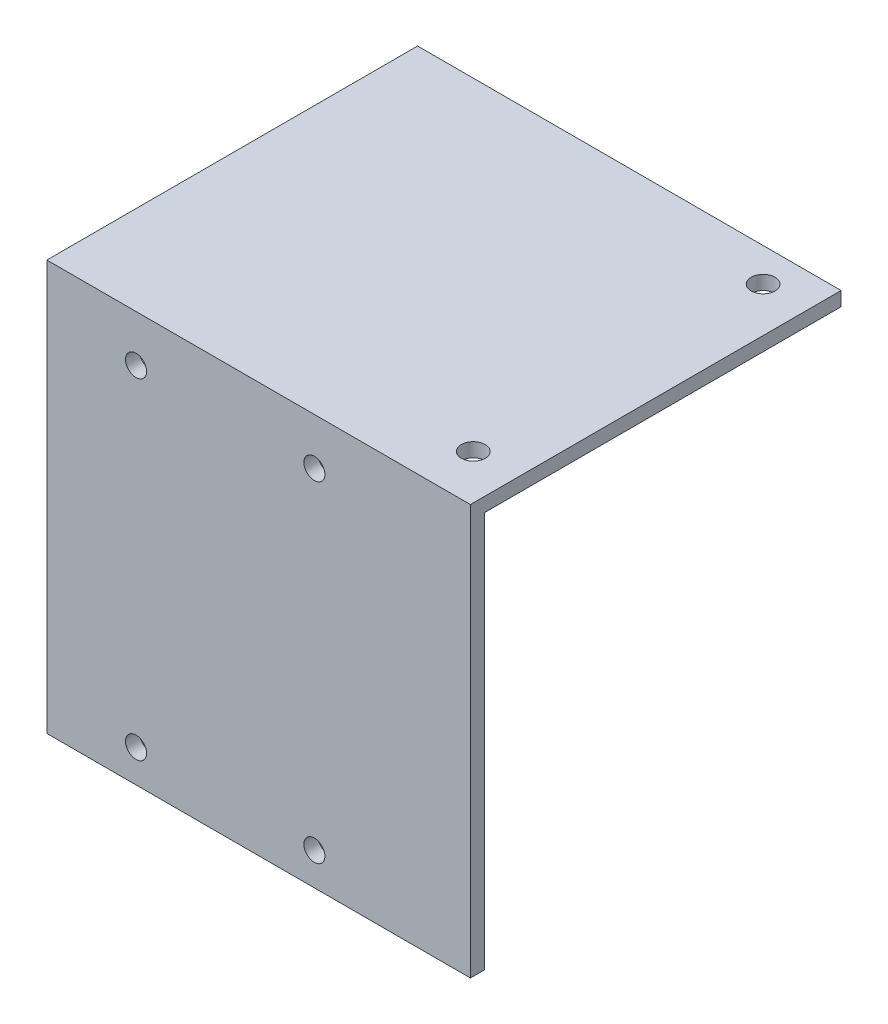
from build123d import *

# Parameters (mm, degrees)
SKETCH1_W           = 60.325
SKETCH1_H           = 58.4
SKETCH1_R           = 1.5
BOSS_EXTRUDE1_DEPTH = 2
SKETCH2_W           = 60.325
SKETCH2_H           = 2
BOSS_EXTRUDE2_DEPTH = 50.8
SKETCH3_R           = 1.7
CUT_EXTRUDE1_DEPTH  = 100.184200481


with BuildPart() as part:
    # Sketch1 → Boss-Extrude1 (new body)
    with BuildSketch(Plane.XY):
        with Locations((30.1625, 29.2)):
            Rectangle(SKETCH1_W, SKETCH1_H)
        with Locations((12.7, 51.75)):
            Circle(SKETCH1_R, mode=Mode.SUBTRACT)
        with Locations((38.1, 51.75)):
            Circle(SKETCH1_R, mode=Mode.SUBTRACT)
        with Locations((12.7, 4.65)):
            Circle(SKETCH1_R, mode=Mode.SUBTRACT)
        with Locations((38.1, 4.65)):
            Circle(SKETCH1_R, mode=Mode.SUBTRACT)
    extrude(amount=-BOSS_EXTRUDE1_DEPTH)

    # Sketch2 → Boss-Extrude2 (add)
    with BuildSketch(Plane(origin=(0, 0, -2), x_dir=(-1, 0, 0), z_dir=(0, 0, -1))):
        with Locations((-30.1625, 57.4)):
            Rectangle(SKETCH2_W, SKETCH2_H)
    extrude(amount=BOSS_EXTRUDE2_DEPTH)

    # Sketch3 → Cut-Extrude1 (cut, through all)
    with BuildSketch(Plane(origin=(0, 58.4, 0), x_dir=(1, 0, 0), z_dir=(0, 1, 0))):
        with Locations((53.975, 48.0375)):
            Circle(SKETCH3_R)
        with Locations((53.975, 6.7625)):
            Circle(SKETCH3_R)
    extrude(amount=-CUT_EXTRUDE1_DEPTH, mode=Mode.SUBTRACT)


solid = part.part
